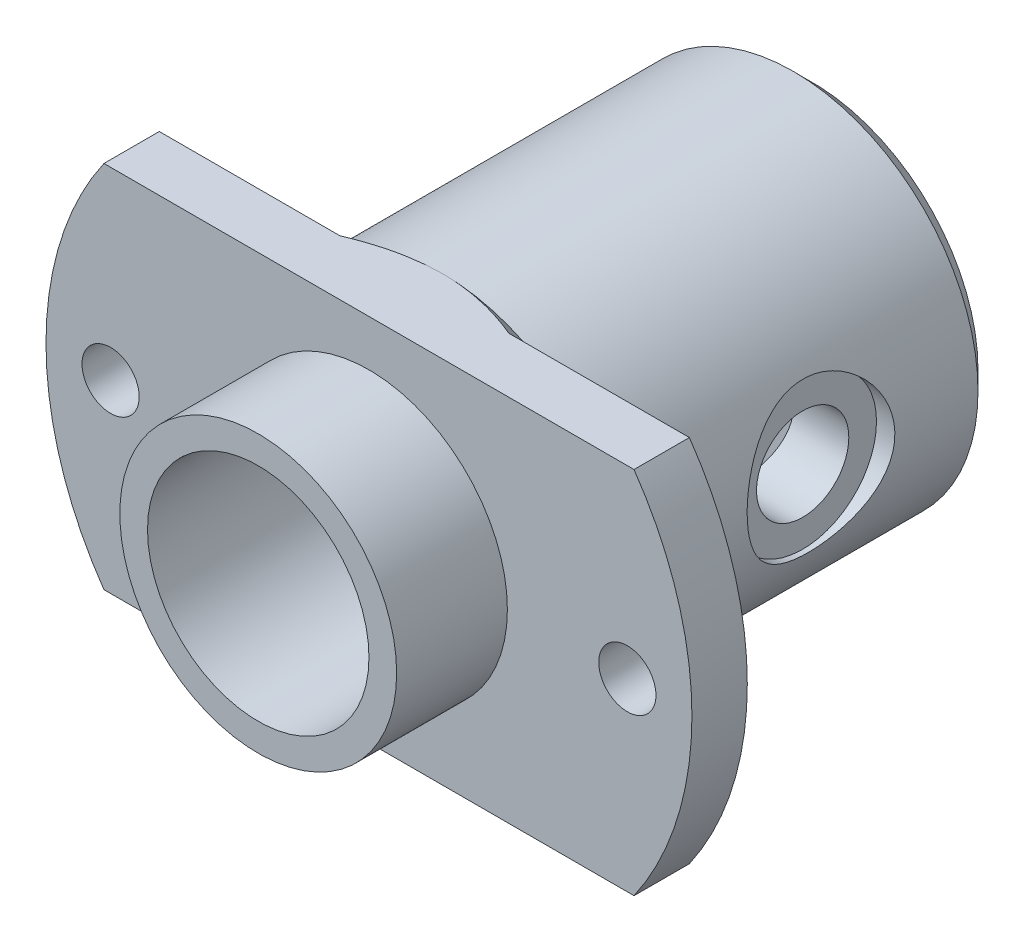
from build123d import *

# Parameters (mm, degrees)
SKETCH2_R           = 10
BOSS_EXTRUDE1_DEPTH = 21
SKETCH3_R           = 1.55
BOSS_EXTRUDE3_DEPTH = 3
SKETCH4_R           = 7.5
BOSS_EXTRUDE4_DEPTH = 6
SKETCH5_R           = 6
CUT_EXTRUDE1_DEPTH  = 25
SKETCH6_R           = 4
CUT_EXTRUDE2_DEPTH  = 1
SKETCH7_R           = 2.5
CUT_EXTRUDE3_DEPTH  = 7
CHAMFER1_SIZE       = 1
CHAMFER2_SIZE       = 1


with BuildPart() as part:
    # Sketch2 → Boss-Extrude1 (new body)
    with BuildSketch(Plane.XY):
        with Locations(Location((0, 0, 0), (0, 0, 180))):
            Circle(SKETCH2_R)
    extrude(amount=BOSS_EXTRUDE1_DEPTH)

    # Sketch3 → Boss-Extrude3 (add)
    with BuildSketch(Plane.XY.offset(21)):
        with BuildLine():
            Line((14.361406616, 10), (-14.361406616, 10))
            ThreePointArc((-14.361406616, 10), (-17.5, 0), (-14.361406616, -10))
            Line((-14.361406616, -10), (14.361406616, -10))
            ThreePointArc((14.361406616, -10), (17.5, 0), (14.361406616, 10))
        make_face()
        with Locations((14, 0)):
            Circle(SKETCH3_R, mode=Mode.SUBTRACT)
        with Locations((-14, 0)):
            Circle(SKETCH3_R, mode=Mode.SUBTRACT)
    extrude(amount=BOSS_EXTRUDE3_DEPTH)

    # Sketch4 → Boss-Extrude4 (add)
    with BuildSketch(Plane.XY.offset(24)):
        Circle(SKETCH4_R)
    extrude(amount=BOSS_EXTRUDE4_DEPTH)

    # Sketch5 → Cut-Extrude1 (cut)
    with BuildSketch(Plane.XY.offset(30)):
        Circle(SKETCH5_R)
    extrude(amount=-CUT_EXTRUDE1_DEPTH, mode=Mode.SUBTRACT)

    # Sketch6 → Cut-Extrude2 (cut)
    with BuildSketch(Plane(origin=(10, 0, 0), x_dir=(0, 0, -1), z_dir=(1, 0, 0))):
        with Locations((-9.5, 0.3231801)):
            Circle(SKETCH6_R)
    extrude(amount=-CUT_EXTRUDE2_DEPTH, mode=Mode.SUBTRACT)

    # Sketch7 → Cut-Extrude3 (cut)
    with BuildSketch(Plane(origin=(9, 0, 0), x_dir=(0, 0, -1), z_dir=(1, 0, 0))):
        with Locations((-9.5, 0.3231801)):
            Circle(SKETCH7_R)
    extrude(amount=-CUT_EXTRUDE3_DEPTH, mode=Mode.SUBTRACT)

    # Chamfer1
    chamfer1_edges = [part.edges().sort_by_distance(p)[0] for p in [
        (10, 0, 0),
    ]]
    chamfer(chamfer1_edges, length=CHAMFER1_SIZE)

    # Chamfer2
    # the kernel refuses this chamfer: 1 mm, written as the material it adds along each edge
    with BuildSketch(Plane(origin=(0, 0, 21), x_dir=(-1, 0, 0), z_dir=(0, 1, 0))) as chamfer2_piece_1_section:
        Polygon((10, -CHAMFER2_SIZE), (10 + CHAMFER2_SIZE, 0), (10, 0), align=None)
    chamfer2_piece_1 = revolve(axis=Axis((0, 0, 21), (0, 0, 1)), revolution_arc=90.000000093, mode=Mode.PRIVATE)
    chamfer2_piece_1 = split(chamfer2_piece_1, bisect_by=Plane(origin=(-7.415105154, -10, 20.513457715), z_dir=(0, 1, 0)), keep=Keep.TOP, mode=Mode.PRIVATE)
    add(chamfer2_piece_1)
    with BuildSketch(Plane(origin=(0, 0, 21), x_dir=(1.6193002877922622e-09, -1.0, 0), z_dir=(-1.0, -1.6193002877922622e-09, 0))) as chamfer2_piece_2_section:
        Polygon((10, -CHAMFER2_SIZE), (10 + CHAMFER2_SIZE, 0), (10, 0), align=None)
    chamfer2_piece_2 = revolve(axis=Axis((0, 0, 21), (0, 0, 1)), revolution_arc=180.00000015, mode=Mode.PRIVATE)
    chamfer2_piece_2 = split(chamfer2_piece_2, bisect_by=Plane(origin=(10.48304434, 10, 20.516955657), z_dir=(0, -1, 0)), keep=Keep.TOP, mode=Mode.PRIVATE)
    chamfer2_piece_2 = split(chamfer2_piece_2, bisect_by=Plane(origin=(10.48304434, -10, 20.516955657), z_dir=(0, 1, 0)), keep=Keep.TOP, mode=Mode.PRIVATE)
    add(chamfer2_piece_2)
    with BuildSketch(Plane(origin=(0, 0, 21), x_dir=(-4.239322364523242e-09, 1.0, 0), z_dir=(1.0, 4.239322364523242e-09, 0))) as chamfer2_piece_3_section:
        Polygon((10, -CHAMFER2_SIZE), (10 + CHAMFER2_SIZE, 0), (10, 0), align=None)
    chamfer2_piece_3 = revolve(axis=Axis((0, 0, 21), (0, 0, 1)), revolution_arc=89.999999757, mode=Mode.PRIVATE)
    chamfer2_piece_3 = split(chamfer2_piece_3, bisect_by=Plane(origin=(-7.415105177, 10, 20.513457715), z_dir=(0, -1, 0)), keep=Keep.TOP, mode=Mode.PRIVATE)
    add(chamfer2_piece_3)


solid = part.part
